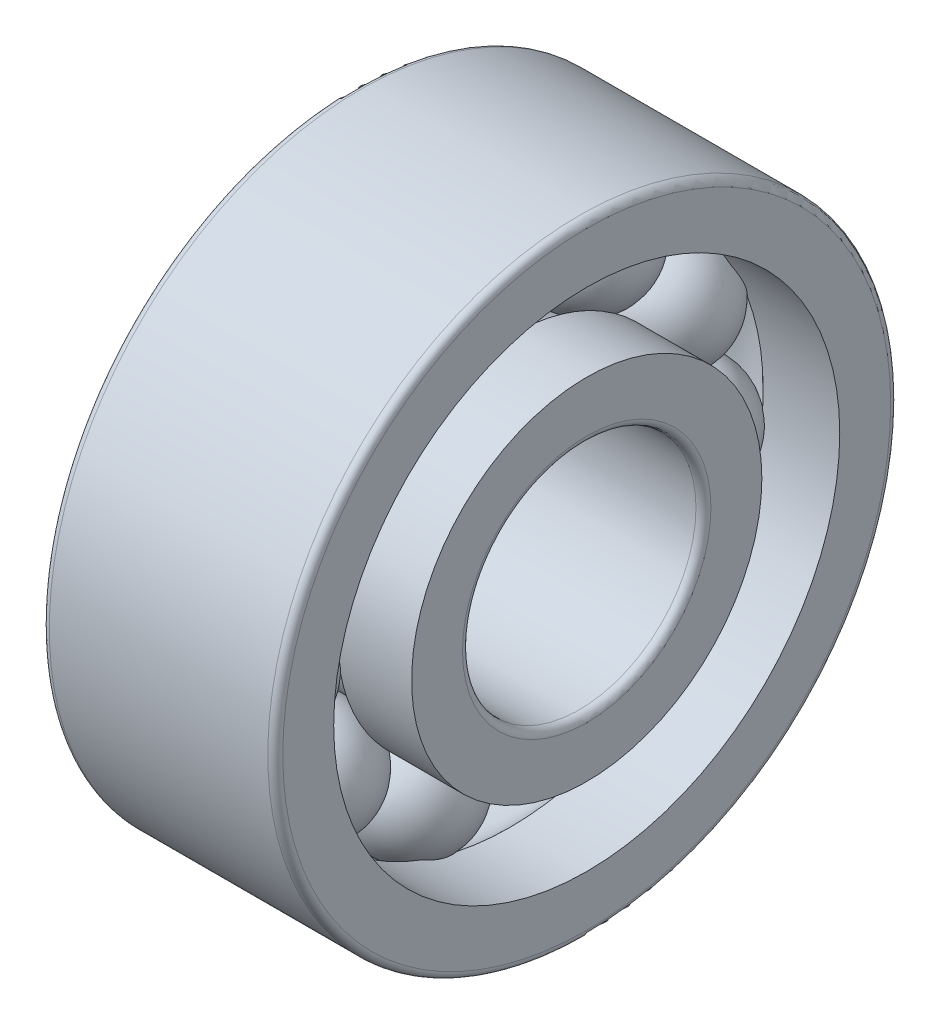
from build123d import *

# Parameters (mm, degrees)
CAGSPISKE_W         = 0.1191006
CAGSPISKE_H         = 0.198501
CAGESPINE_ANGLE     = 0.001
BALLSDETAILED_COUNT = 11
BALLSDETAILED_ANGLE = 327.272727273


with BuildPart() as part:
    # CagSpiSke → CageSpine (revolve)
    with BuildSketch(Plane.XY):
        with Locations((0, 2.182495)):
            Rectangle(CAGSPISKE_W, CAGSPISKE_H)
    revolve(axis=Axis((-20.6375, 0, 0), (-1, 0, 0)), revolution_arc=CAGESPINE_ANGLE)

    # BalDetSke → BallDetailed (revolve)
    with BuildSketch(Plane.XY):
        with BuildLine():
            Line((-0.595503, 2.182495), (0.595503, 2.182495))
            ThreePointArc((0.595503, 2.182495), (0, 1.586992), (-0.595503, 2.182495))
        make_face()
    balldetailed = revolve(axis=Axis((-1.905, 2.182495, 0), (1, 0, 0)))

    # InnRacSke → InnerRace (revolve)
    with BuildSketch(Plane.XY):
        with BuildLine():
            Line((-0.383753813, 1.785493), (-1.18999, 1.785493))
            Line((-1.18999, 1.785493), (-1.18999, 1.26619))
            ThreePointArc((-1.18999, 1.26619), (-1.167671537, 1.212308463), (-1.11379, 1.18999))
            Line((-1.11379, 1.18999), (1.11379, 1.18999))
            ThreePointArc((1.11379, 1.18999), (1.167671537, 1.212308463), (1.18999, 1.26619))
            Line((1.18999, 1.26619), (1.18999, 1.785493))
            Line((1.18999, 1.785493), (0.434553813, 1.785493))
            ThreePointArc((0.434553813, 1.785493), (0.0254, 1.612392), (-0.383753813, 1.785493))
        make_face()
    revolve(axis=Axis((-20.6375, 0, 0), (1, 0, 0)))

    # OutRacSke → OuterRace (revolve)
    with BuildSketch(Plane.XY):
        with BuildLine():
            Line((-0.409153813, 2.579497), (-1.18999, 2.579497))
            Line((-1.18999, 2.579497), (-1.18999, 3.0988))
            ThreePointArc((-1.18999, 3.0988), (-1.167671537, 3.152681537), (-1.11379, 3.175))
            Line((-1.11379, 3.175), (1.11379, 3.175))
            ThreePointArc((1.11379, 3.175), (1.167671537, 3.152681537), (1.18999, 3.0988))
            Line((1.18999, 3.0988), (1.18999, 2.579497))
            Line((1.18999, 2.579497), (0.409153813, 2.579497))
            ThreePointArc((0.409153813, 2.579497), (0, 2.752598), (-0.409153813, 2.579497))
        make_face()
    revolve(axis=Axis((-20.6375, 0, 0), (1, 0, 0)))

    # BallsDetailed: BallDetailed ×11 about axis
    ballsdetailed_axis = Axis((-50, 0, 0), (1, 0, 0))
    for i in range(1, BALLSDETAILED_COUNT):
        add(balldetailed.rotate(ballsdetailed_axis, i * BALLSDETAILED_ANGLE / (BALLSDETAILED_COUNT - 1)))


solid = part.part
